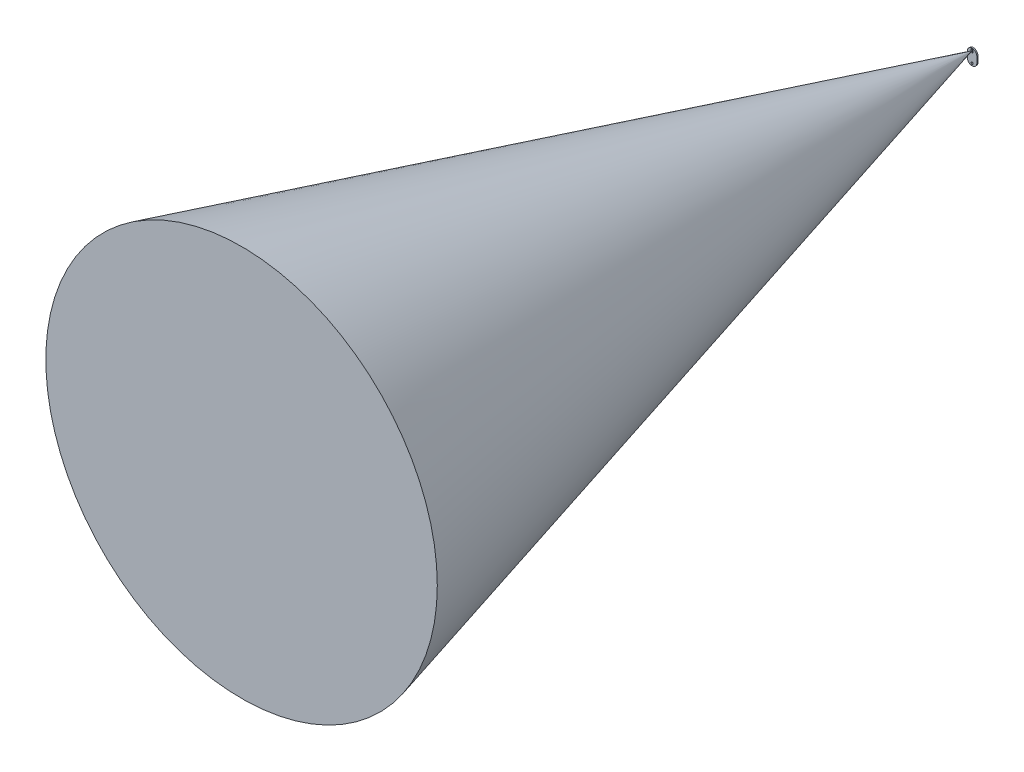
from build123d import *

# Parameters (mm, degrees)
ESQUISSE1_R        = 1.5
BOSS_EXTRU_1_DEPTH = 1.6
ESQUISSE2_W        = 2
ESQUISSE2_H        = 4
BOSS_EXTRU_2_DEPTH = 1


with BuildPart() as part:
    # Esquisse1 → Boss.-Extru.1 (new body)
    with BuildSketch(Plane.XY):
        with BuildLine():
            Line((6.5, -3.5), (6.5, -11.5))
            ThreePointArc((6.5, -11.5), (0, -18), (-6.5, -11.5))
            Line((-6.5, -11.5), (-6.5, -3.5))
            ThreePointArc((-6.5, -3.5), (0, 3), (6.5, -3.5))
        make_face()
        with Locations((0, -15)):
            Circle(ESQUISSE1_R, mode=Mode.SUBTRACT)
    extrude(amount=BOSS_EXTRU_1_DEPTH)

    # Esquisse2 → Boss.-Extru.2 (add)
    with BuildSketch(Plane.XY.offset(1.6)):
        Rectangle(ESQUISSE2_W, ESQUISSE2_H)
    extrude(amount=BOSS_EXTRU_2_DEPTH)

    # Esquisse3 → Révolution1 (revolve)
    with BuildSketch(Plane(origin=(0, 0, 0), x_dir=(0, 0, -1), z_dir=(1, 0, 0))):
        Polygon((-1.6, 0), (-1001.6, 0), (-1001.6, 267.949192431), align=None)
    revolve(axis=Axis((0, 0, 0), (0, 0, 1)))


solid = part.part
